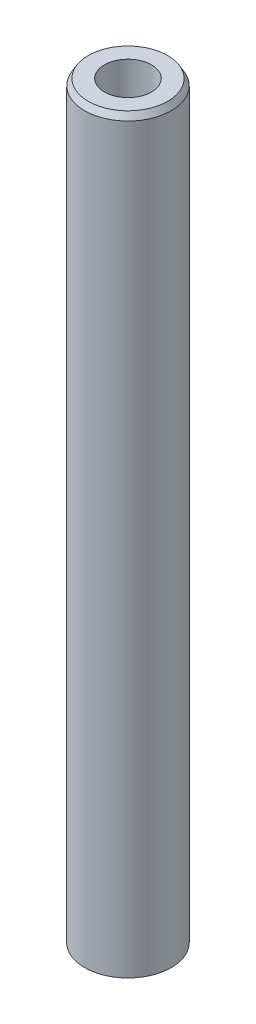
from build123d import *
from OCP.BRepFilletAPI import BRepFilletAPI_MakeChamfer

# Parameters (mm, degrees)
SKETCH1_R           = 15
BOSS_EXTRUDE1_DEPTH = 260.302804773
SKETCH2_R           = 8.155604256
CUT_EXTRUDE1_DEPTH  = 262.165752296
CHAMFER1_SIZE       = 2.180532526
CHAMFER1_SIZE2      = 1.258931041


with BuildPart() as part:
    # Sketch1 → Boss-Extrude1 (new body)
    with BuildSketch(Plane(origin=(0, 0, 0), x_dir=(1, 0, 0), z_dir=(0, 1, 0))):
        Circle(SKETCH1_R)
    extrude(amount=BOSS_EXTRUDE1_DEPTH)

    # Sketch2 → Cut-Extrude1 (cut, through all)
    with BuildSketch(Plane(origin=(0, 0, 0), x_dir=(1, 0, 0), z_dir=(0, 1, 0))):
        Circle(SKETCH2_R)
    extrude(amount=CUT_EXTRUDE1_DEPTH, mode=Mode.SUBTRACT)

    # Chamfer1: one chamfer whose edges measure the first distance from different faces: ONE call of the kernel's chamfer builder (chamfer() names one face for all edges)
    chamfer1_edges_1 = [part.edges().sort_by_distance(p)[0] for p in [
        (-15, 260.302804773, 0),
    ]]
    chamfer1_side_1 = [part.faces().sort_by_distance(p)[0] for p in [
        (-15, 130.151402386, 0),
    ]]
    chamfer1_edges_2 = [part.edges().sort_by_distance(p)[0] for p in [
        (-15, 0, 0),
    ]]
    chamfer1_side_2 = [part.faces().sort_by_distance(p)[0] for p in [
        (-14.575735931, 0, 0),
    ]]
    chamfer1 = BRepFilletAPI_MakeChamfer(part.part.solid().wrapped)
    for e in chamfer1_edges_1:
        chamfer1.Add(CHAMFER1_SIZE, CHAMFER1_SIZE2, e.wrapped, chamfer1_side_1[0].wrapped)  # the first distance lies on this face
    for e in chamfer1_edges_2:
        chamfer1.Add(CHAMFER1_SIZE, CHAMFER1_SIZE2, e.wrapped, chamfer1_side_2[0].wrapped)  # the first distance lies on this face
    add(Compound.cast(chamfer1.Shape()), mode=Mode.REPLACE)


solid = part.part
